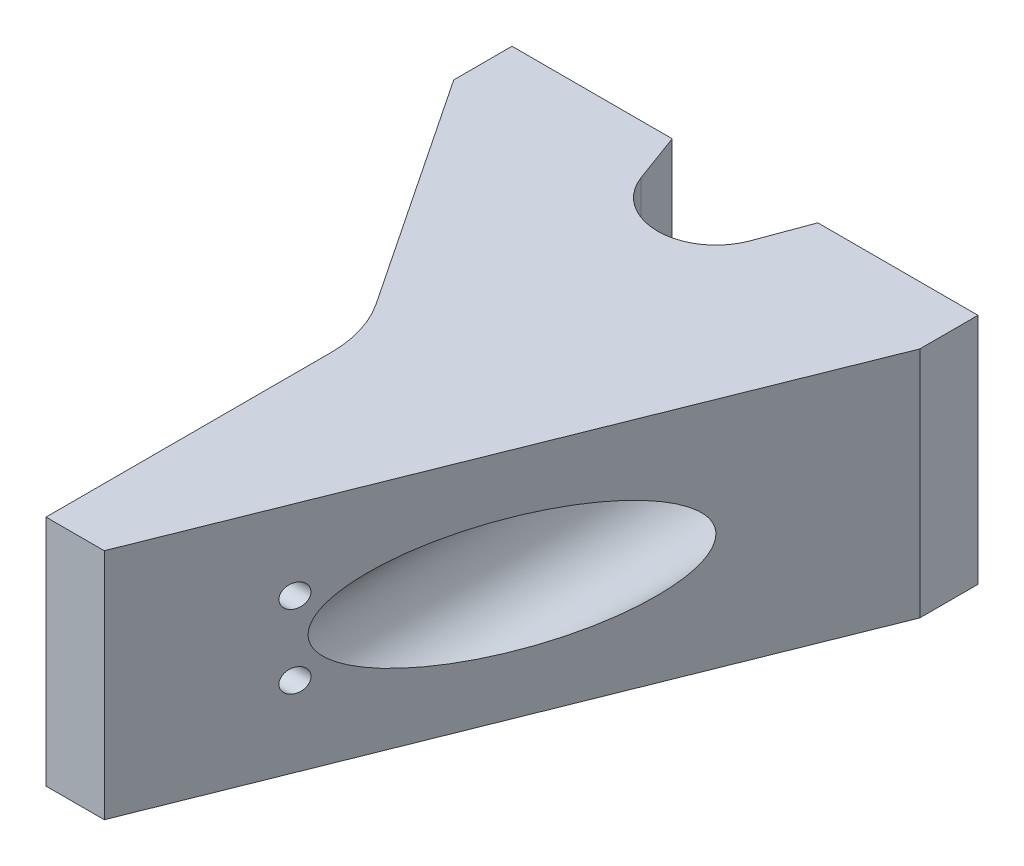
from build123d import *

# Parameters (mm, degrees)
BOSS_EXTRUDE1_DEPTH   = 12.7
LPATTERN1_COUNT       = 2
LPATTERN1_PITCH       = 25.4
M3X0_5_TAPPED_HOLE1_D = 2.5


with BuildPart() as part:
    # Sketch1 → Boss-Extrude1 (new, symmetric)
    with BuildSketch(Plane(origin=(0, 0, 0), x_dir=(1, 0, 0), z_dir=(0, 1, 0))):
        with BuildLine():
            Line((0, 0), (17.4625, 0))
            Line((17.4625, 0), (19.441706855, -5.370732862))
            ThreePointArc((19.441706855, -5.370732862), (25.4, -9.525), (31.358293145, -5.370732862))
            Line((31.358293145, -5.370732862), (33.3375, 0))
            Line((33.3375, 0), (50.8, 0))
            Line((50.8, 0), (50.8, -6.35))
            Line((50.8, -6.35), (25.4, -69.85))
            Line((25.4, -69.85), (19.05, -69.85))
            Line((19.05, -69.85), (19.05, -38.770250599))
            ThreePointArc((19.05, -38.770250599), (18.505068736, -35.089991911), (16.917038738, -31.725558107))
            Line((16.917038738, -31.725558107), (0, -6.35))
            Line((0, -6.35), (0, 0))
        make_face()
    extrude(amount=BOSS_EXTRUDE1_DEPTH, both=True)

    # Sketch2 → Cut-Revolve1 (revolve, cut)
    with BuildSketch(Plane(origin=(0, 0, 0), x_dir=(1, 0, 0), z_dir=(0, 1, 0))):
        Polygon((12.7, 0), (12.7, -117.475), (6.35, -117.475), (6.35, -9.525), (10.1473, -9.525), (10.1473, 0), align=None)
    cut_revolve1 = revolve(axis=Axis((12.7, 0, 0), (0, 0, -1)), mode=Mode.SUBTRACT)

    # LPattern1: Cut-Revolve1 ×2
    with Locations(*[(i * LPATTERN1_PITCH, 0, 0) for i in range(1, LPATTERN1_COUNT)]):
        add(cut_revolve1, mode=Mode.SUBTRACT)

    # M3x0.5 Tapped Hole1 (through all)
    with Locations(Plane.ZY.offset(-19.05)):
        with Locations((55, 4), (55, -4)):
            Hole(M3X0_5_TAPPED_HOLE1_D / 2)


solid = part.part
